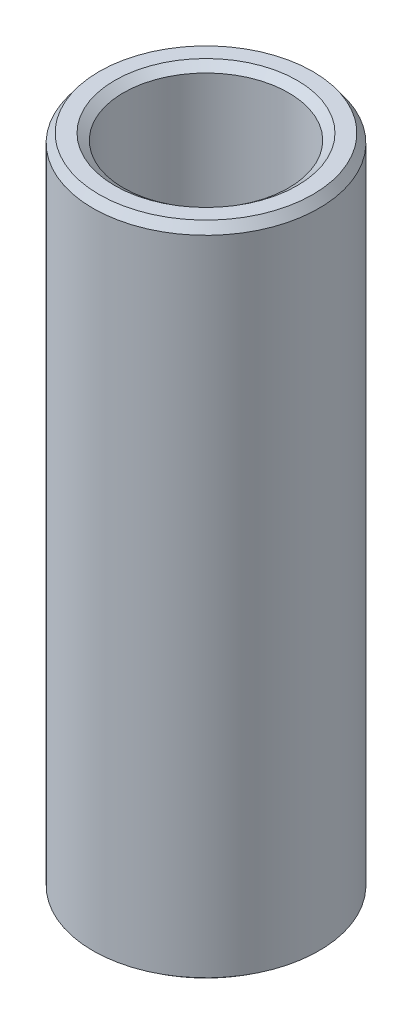
from build123d import *
from OCP.BRepFilletAPI import BRepFilletAPI_MakeChamfer

# Parameters (mm, degrees)
SKETCH1_R           = 50
BOSS_EXTRUDE1_DEPTH = 290.987460243
SKETCH2_R           = 36.502456666
CUT_EXTRUDE1_DEPTH  = 300.455676217
CHAMFER1_SIZE       = 3.835425812
CHAMFER1_SIZE2      = 2.816486339


with BuildPart() as part:
    # Sketch1 → Boss-Extrude1 (new body)
    with BuildSketch(Plane(origin=(0, 0, 0), x_dir=(1, 0, 0), z_dir=(0, 1, 0))):
        Circle(SKETCH1_R)
    extrude(amount=BOSS_EXTRUDE1_DEPTH)

    # Sketch2 → Cut-Extrude1 (cut, through all)
    with BuildSketch(Plane(origin=(0, 0, 0), x_dir=(1, 0, 0), z_dir=(0, 1, 0))):
        Circle(SKETCH2_R)
    extrude(amount=CUT_EXTRUDE1_DEPTH, mode=Mode.SUBTRACT)

    # Chamfer1: one chamfer whose edges measure the first distance from different faces: ONE call of the kernel's chamfer builder (chamfer() names one face for all edges)
    chamfer1_edges_1 = [part.edges().sort_by_distance(p)[0] for p in [
        (-36.502456666, 290.987460243, 0),
    ]]
    chamfer1_side_1 = [part.faces().sort_by_distance(p)[0] for p in [
        (-48.585786438, 290.987460243, 0),
    ]]
    chamfer1_edges_2 = [part.edges().sort_by_distance(p)[0] for p in [
        (-36.502456666, 0, 0),
    ]]
    chamfer1_side_2 = [part.faces().sort_by_distance(p)[0] for p in [
        (-36.502456666, 145.493730121, 0),
    ]]
    chamfer1_edges_3 = [part.edges().sort_by_distance(p)[0] for p in [
        (-50, 0, 0),
    ]]
    chamfer1_side_3 = [part.faces().sort_by_distance(p)[0] for p in [
        (-48.585786438, 0, 0),
    ]]
    chamfer1_edges_4 = [part.edges().sort_by_distance(p)[0] for p in [
        (-50, 290.987460243, 0),
    ]]
    chamfer1_side_4 = [part.faces().sort_by_distance(p)[0] for p in [
        (-50, 145.493730121, 0),
    ]]
    chamfer1 = BRepFilletAPI_MakeChamfer(part.part.solid().wrapped)
    for e in chamfer1_edges_1:
        chamfer1.Add(CHAMFER1_SIZE, CHAMFER1_SIZE2, e.wrapped, chamfer1_side_1[0].wrapped)  # the first distance lies on this face
    for e in chamfer1_edges_2:
        chamfer1.Add(CHAMFER1_SIZE, CHAMFER1_SIZE2, e.wrapped, chamfer1_side_2[0].wrapped)  # the first distance lies on this face
    for e in chamfer1_edges_3:
        chamfer1.Add(CHAMFER1_SIZE, CHAMFER1_SIZE2, e.wrapped, chamfer1_side_3[0].wrapped)  # the first distance lies on this face
    for e in chamfer1_edges_4:
        chamfer1.Add(CHAMFER1_SIZE, CHAMFER1_SIZE2, e.wrapped, chamfer1_side_4[0].wrapped)  # the first distance lies on this face
    add(Compound.cast(chamfer1.Shape()), mode=Mode.REPLACE)


solid = part.part
